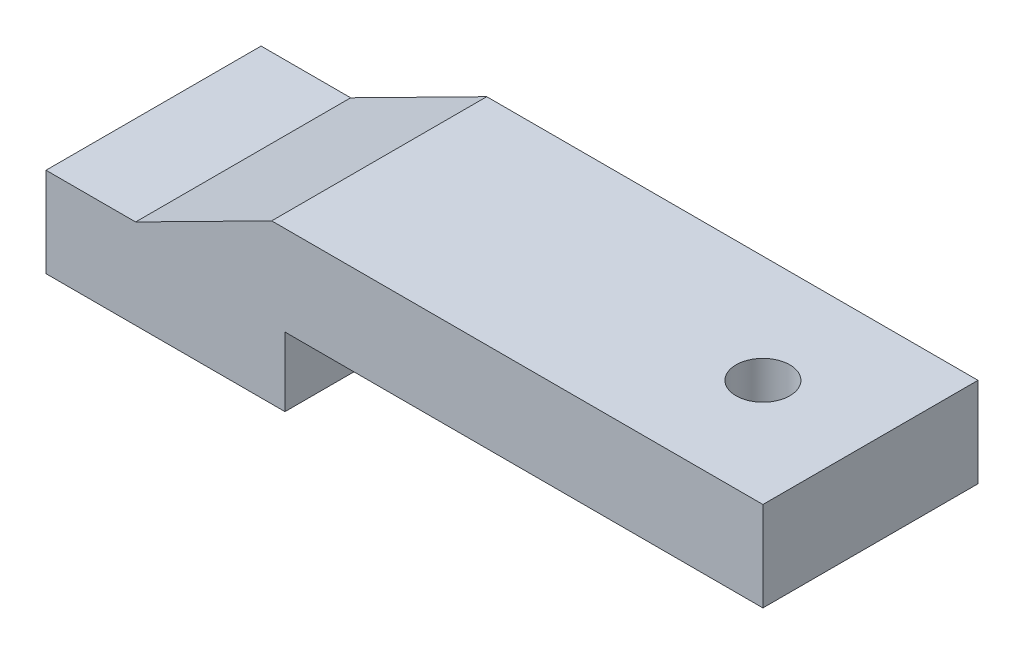
from build123d import *

# Parameters (mm, degrees)
BOSS_EXTRUDE1_DEPTH = 36
SKETCH2_R           = 4.5
CUT_EXTRUDE1_DEPTH  = 30


with BuildPart() as part:
    # Sketch1 → Boss-Extrude1 (new body)
    with BuildSketch(Plane.XY):
        Polygon((-70.962654933, -26.546784039), (-30.962654933, -26.546784039), (-30.962654933, -15.688919663), (-30.962654933, -15), (-29.603926395, -15), (0.496524767, -15), (49.037345067, -15), (49.037345067, 0), (-33.18939726, 0), (-55.962654933, -11.546784039), (-70.962654933, -11.546784039), align=None)
    extrude(amount=BOSS_EXTRUDE1_DEPTH)

    # Sketch2 → Cut-Extrude1 (cut)
    with BuildSketch(Plane(origin=(0, 0, 0), x_dir=(1, 0, 0), z_dir=(0, 1, 0))):
        with Locations((31.037345067, -18)):
            Circle(SKETCH2_R)
    extrude(amount=-CUT_EXTRUDE1_DEPTH, mode=Mode.SUBTRACT)


solid = part.part
